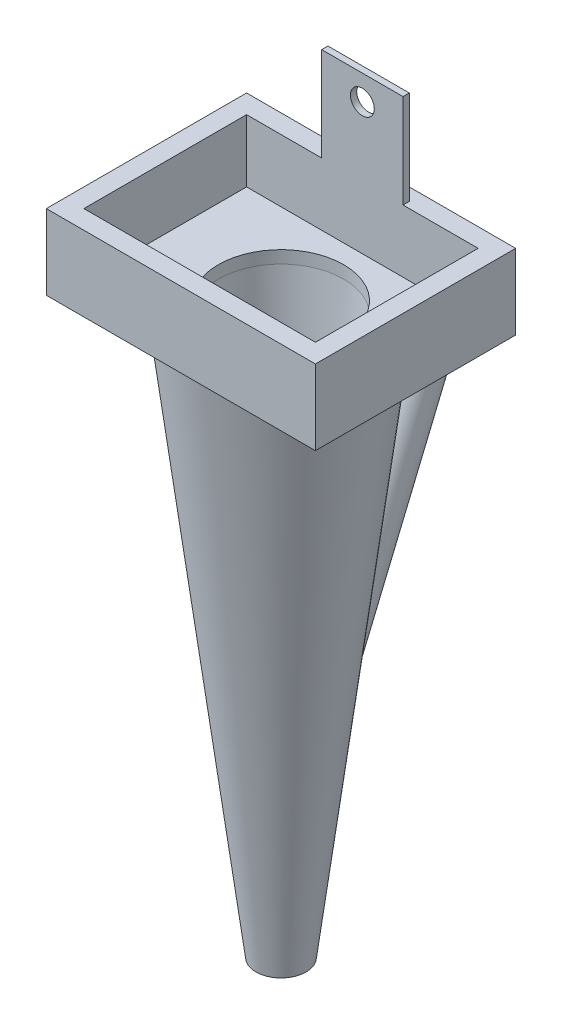
from build123d import *

# Parameters (mm, degrees)
SKETCH1_W           = 43
SKETCH1_H           = 32
SKETCH1_W_2         = 37
SKETCH1_H_2         = 26
BOSS_EXTRUDE1_DEPTH = 10
SKETCH2_W           = 13
SKETCH2_H           = 1
BOSS_EXTRUDE2_DEPTH = 15
CUT_EXTRUDE1_REACH  = 57.902
SKETCH3_R           = 1.905
SKETCH4_W           = 43
SKETCH4_H           = 32
BOSS_EXTRUDE3_DEPTH = 2
CUT_EXTRUDE2_REACH  = 58.303
SKETCH5_R           = 10
SKETCH14_R          = 3.4925
BOSS_EXTRUDE4_DEPTH = 45
SKETCH16_R          = 1.9925
CUT_EXTRUDE3_DEPTH  = 50


with BuildPart() as part:
    # Sketch1 → Boss-Extrude1 (new body)
    with BuildSketch(Plane(origin=(0, 0, 0), x_dir=(1, 0, 0), z_dir=(0, 1, 0))):
        with Locations((18.5, 13)):
            Rectangle(SKETCH1_W, SKETCH1_H)
        with Locations((18.5, 13)):
            Rectangle(SKETCH1_W_2, SKETCH1_H_2, mode=Mode.SUBTRACT)
    extrude(amount=BOSS_EXTRUDE1_DEPTH)

    # Sketch2 → Boss-Extrude2 (add)
    with BuildSketch(Plane(origin=(0, 10, 0), x_dir=(1, 0, 0), z_dir=(0, 1, 0))):
        with Locations((18.5, 26.5)):
            Rectangle(SKETCH2_W, SKETCH2_H)
    extrude(amount=BOSS_EXTRUDE2_DEPTH)

    # Sketch3 → Cut-Extrude1 (cut, up to next)
    with BuildSketch(Plane(origin=(0, 0, -27), x_dir=(-1, 0, 0), z_dir=(0, 0, -1)), mode=Mode.PRIVATE) as cut_extrude1_sk1:
        with Locations((-18.5, 21)):
            Circle(SKETCH3_R)
    cut_extrude1_tool1 = extrude(cut_extrude1_sk1.sketch, amount=-CUT_EXTRUDE1_REACH, mode=Mode.PRIVATE) & part.part
    add(cut_extrude1_tool1.solids().sort_by_distance((18.5, 21, -27))[0], mode=Mode.SUBTRACT)

    # Sketch4 → Boss-Extrude3 (add)
    with BuildSketch(Plane.XZ):
        with Locations((18.5, -13)):
            Rectangle(SKETCH4_W, SKETCH4_H)
    extrude(amount=BOSS_EXTRUDE3_DEPTH)

    # Sketch5 → Cut-Extrude2 (cut, up to next)
    with BuildSketch(Plane.XZ.offset(2), mode=Mode.PRIVATE) as cut_extrude2_sk1:
        with Locations((18.5, -13)):
            Circle(SKETCH5_R)
    cut_extrude2_tool1 = extrude(cut_extrude2_sk1.sketch, amount=-CUT_EXTRUDE2_REACH, mode=Mode.PRIVATE) & part.part
    add(cut_extrude2_tool1.solids().sort_by_distance((18.5, -2, -13))[0], mode=Mode.SUBTRACT)

    # Sketch9 → Revolve1 (revolve)
    with BuildSketch(Plane.XY.offset(-13)):
        Polygon((28.5, -2), (21.5, -90.9), (22.5, -90.9), (33.5, -2), align=None)
    revolve(axis=Axis((18.5, -2, -13), (0, -1, 0)))

    # Sketch14 → Boss-Extrude4 (add)
    with BuildSketch(Plane(origin=(18.5, -19.108562857, -35.499809934), x_dir=(-1, 0, 0), z_dir=(0, -0.9227821187332675, 0.38532215268025))):
        with Locations((0.305660396, 0)):
            Circle(SKETCH14_R)
    extrude(amount=BOSS_EXTRUDE4_DEPTH)

    # Sketch16 → Cut-Extrude3 (cut)
    with BuildSketch(Plane(origin=(0, -3.648843771, 1.523631969), x_dir=(1, 0, 0), z_dir=(0, 0.9227821187332675, -0.38532215268025005))):
        with Locations((18.194339604, 40.1215424)):
            Circle(SKETCH16_R)
    extrude(amount=-CUT_EXTRUDE3_DEPTH, mode=Mode.SUBTRACT)


solid = part.part
